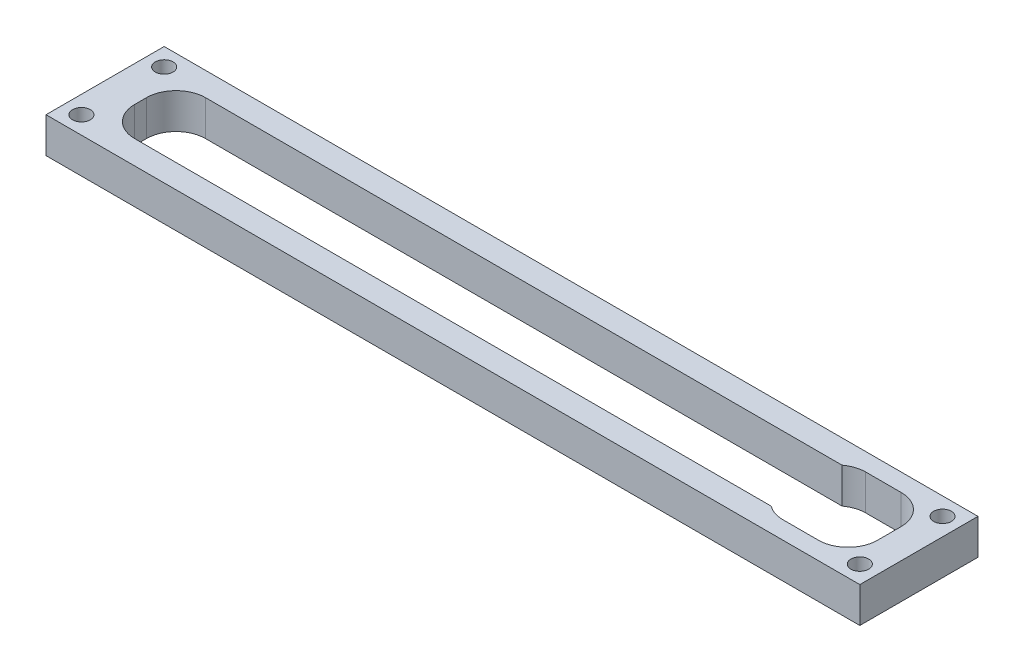
from build123d import *

# Parameters (mm, degrees)
SKETCH1_W           = 137.727780531
SKETCH1_H           = 20
SKETCH1_R           = 1.5
SKETCH1_W_2         = 125.727780531
SKETCH1_H_2         = 12
BOSS_EXTRUDE1_DEPTH = 6
CUT_EXTRUDE1_DEPTH  = 140.301620701
FILLET1_R           = 5


with BuildPart() as part:
    # Sketch1 → Boss-Extrude1 (new body)
    with BuildSketch(Plane(origin=(0, 0, 0), x_dir=(1, 0, 0), z_dir=(0, 1, 0))):
        with Locations((68.863890266, 10)):
            Rectangle(SKETCH1_W, SKETCH1_H)
        with Locations(Location((3, 17, 0), (0, 0, 270))):
            Circle(SKETCH1_R, mode=Mode.SUBTRACT)
        with Locations(Location((3, 3, 0), (0, 0, 90))):
            Circle(SKETCH1_R, mode=Mode.SUBTRACT)
        with Locations(Location((134.727780531, 3, 0), (0, 0, 270))):
            Circle(SKETCH1_R, mode=Mode.SUBTRACT)
        with Locations(Location((134.727780531, 17, 0), (0, 0, 90))):
            Circle(SKETCH1_R, mode=Mode.SUBTRACT)
        with Locations((68.863890266, 10)):
            Rectangle(SKETCH1_W_2, SKETCH1_H_2, mode=Mode.SUBTRACT)
    extrude(amount=BOSS_EXTRUDE1_DEPTH)

    # Sketch2 → Cut-Extrude1 (cut, through all)
    with BuildSketch(Plane(origin=(0, 6, 0), x_dir=(1, 0, 0), z_dir=(0, 1, 0))):
        Polygon((118.727780531, 17), (118.727780531, 16), (131.727780531, 16), (131.727780531, 4), (118.727780531, 4), (118.727780531, 3), (132.727780531, 3), (132.727780531, 17), align=None)
    extrude(amount=-CUT_EXTRUDE1_DEPTH, mode=Mode.SUBTRACT)

    # Fillet1
    # the kernel refuses this fillet: 5 mm, written as the material it adds along each edge
    with BuildSketch(Plane(origin=(132.727780531, 6, -17), x_dir=(0, 0, 1), z_dir=(0, -1, 0)), Plane(origin=(132.727780531, 6, -3), x_dir=(-1, 0, 0), z_dir=(0, -1, 0)), Plane(origin=(6, 0, -16), x_dir=(0, 0, 1), z_dir=(0, 1, 0))) as fillet1_piece_1:
        with BuildLine():
            CenterArc((FILLET1_R, FILLET1_R), FILLET1_R, 180, 90)
            Line((0, FILLET1_R), (-FILLET1_R * 0.02, FILLET1_R))
            Line((-FILLET1_R * 0.02, FILLET1_R), (-FILLET1_R * 0.02, -FILLET1_R * 0.02))
            Line((-FILLET1_R * 0.02, -FILLET1_R * 0.02), (FILLET1_R, -FILLET1_R * 0.02))
            Line((FILLET1_R, -FILLET1_R * 0.02), (FILLET1_R, 0))
        make_face()
    extrude(amount=6)
    with BuildSketch(Plane(origin=(118.727780531, 6, -17), x_dir=(1, 0, 0), z_dir=(0, -1, 0))) as fillet1_piece_2:
        with BuildLine():
            CenterArc((3, 5), FILLET1_R, 233.130102354, 36.869897646)
            Line((0, 1), (-0.06, 0.92))
            ThreePointArc((-0.06, 0.92), (-0.1, 0.5), (-0.1, 0))
            Line((-0.1, 0), (0, -0.1))
            Line((0, -0.1), (3, -0.1))
            Line((3, -0.1), (3, 0))
        make_face()
    extrude(amount=6)
    with BuildSketch(Plane(origin=(118.727780531, 6, -3), x_dir=(0, 0, -1), z_dir=(0, -1, 0))) as fillet1_piece_3:
        with BuildLine():
            CenterArc((5, 3), FILLET1_R, 180, 36.869897646)
            Line((0, 3), (-0.1, 3))
            Line((-0.1, 3), (-0.1, 0))
            Line((-0.1, 0), (0, -0.1))
            ThreePointArc((0, -0.1), (0.5, -0.1), (0.92, -0.06))
            Line((0.92, -0.06), (1, 0))
        make_face()
    extrude(amount=6)
    with BuildSketch(Plane(origin=(6, 0, -4), x_dir=(0, 0, -1), z_dir=(0, 1, 0))) as fillet1_piece_4:
        with BuildLine():
            CenterArc((FILLET1_R, -FILLET1_R), FILLET1_R, 90, 90)
            Line((0, -FILLET1_R), (-FILLET1_R * 0.02, -FILLET1_R))
            Line((-FILLET1_R * 0.02, -FILLET1_R), (-FILLET1_R * 0.02, FILLET1_R * 0.02))
            Line((-FILLET1_R * 0.02, FILLET1_R * 0.02), (FILLET1_R, FILLET1_R * 0.02))
            Line((FILLET1_R, FILLET1_R * 0.02), (FILLET1_R, 0))
        make_face()
    extrude(amount=6)


solid = part.part
